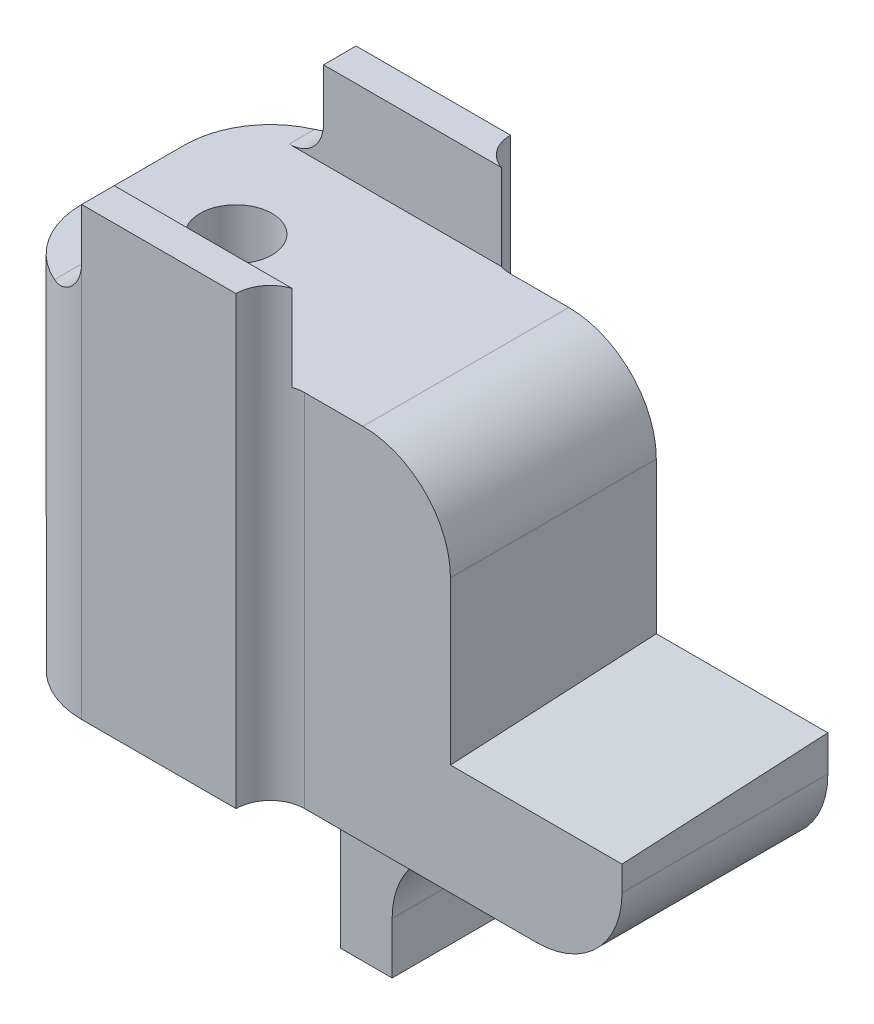
from build123d import *

# Parameters (mm, degrees)
SKETCH1_W           = 12
SKETCH1_H           = 16
SKETCH1_R           = 2.1
SKETCH1_W_2         = 2
BOSS_EXTRUDE1_DEPTH = 21
FILLET1_R           = 5
SKETCH2_W           = 9
SKETCH2_H           = 1.9
BOSS_EXTRUDE2_DEPTH = 5
SKETCH4_W           = 12
SKETCH4_H           = 21
BOSS_EXTRUDE3_DEPTH = 10.5
FILLET2_R           = 5.1
FILLET4_R           = 2
SKETCH6_W           = 3
SKETCH6_H           = 8
BOSS_EXTRUDE5_DEPTH = 8
FILLET6_R           = 2
FILLET8_R           = 5
BOSS_EXTRUDE6_DEPTH = 10
FILLET9_R           = 5


with BuildPart() as part:
    # Sketch1 → Boss-Extrude1 (new body)
    # profile 1 of 2: a face of its own
    with BuildSketch(Plane(origin=(0, 0, 0), x_dir=(1, 0, 0), z_dir=(0, 1, 0))):
        Rectangle(SKETCH1_W, SKETCH1_H)
        with Locations(Location((0, 0, 0), (0, 0, 90))):
            Circle(SKETCH1_R, mode=Mode.SUBTRACT)
    # profile 2 of 2: a face of its own
    with BuildSketch(Plane(origin=(0, 0, 0), x_dir=(1, 0, 0), z_dir=(0, 1, 0))):
        with Locations((7, 0)):
            Rectangle(SKETCH1_W_2, SKETCH1_H)
    extrude(amount=BOSS_EXTRUDE1_DEPTH)

    # Fillet1
    fillet1_edges = [part.edges().sort_by_distance(p)[0] for p in [
        (-6, 10.5, 8),
        (-6, 10.5, -8),
    ]]
    fillet(fillet1_edges, radius=FILLET1_R)

    # Sketch2 → Boss-Extrude2 (add)
    with BuildSketch(Plane(origin=(0, 21, 0), x_dir=(1, 0, 0), z_dir=(0, 1, 0))):
        with Locations((3.5, 7.05)):
            Rectangle(SKETCH2_W, SKETCH2_H)
        with Locations((3.5, -7.05)):
            Rectangle(SKETCH2_W, SKETCH2_H)
    extrude(amount=BOSS_EXTRUDE2_DEPTH)

    # Sketch4 → Boss-Extrude3 (add)
    with BuildSketch(Plane(origin=(8, 0, 0), x_dir=(0, 0, -1), z_dir=(1, 0, 0))):
        with Locations((0, 10.5)):
            Rectangle(SKETCH4_W, SKETCH4_H)
    extrude(amount=BOSS_EXTRUDE3_DEPTH)

    # Fillet2
    fillet2_edges = [part.edges().sort_by_distance(p)[0] for p in [
        (18.5, 21, 0),
    ]]
    fillet(fillet2_edges, radius=FILLET2_R)

    # Fillet4
    fillet4_edges = [part.edges().sort_by_distance(p)[0] for p in [
        (-1, 21, -7.05),
        (-1, 21, 7.05),
        (8, 10.5, -6),
        (8, 10.5, 6),
    ]]
    fillet(fillet4_edges, radius=FILLET4_R - 0.0001)  # a hair under: the kernel refuses the full size

    # Sketch6 → Boss-Extrude5 (add)
    with BuildSketch(Plane.XZ):
        with Locations((11.6, 0)):
            Rectangle(SKETCH6_W, SKETCH6_H)
    extrude(amount=BOSS_EXTRUDE5_DEPTH)

    # Fillet6
    fillet6_edges = [part.edges().sort_by_distance(p)[0] for p in [
        (11.6, 0, -4),
        (11.6, 0, 4),
    ]]
    fillet(fillet6_edges, radius=FILLET6_R - 0.0001)  # a hair under: the kernel refuses the full size

    # Fillet8
    fillet8_edges = [part.edges().sort_by_distance(p)[0] for p in [
        (13.1, 0, 0),
    ]]
    fillet(fillet8_edges, radius=FILLET8_R)

    # Sketch7 → Boss-Extrude6 (add)
    with BuildSketch(Plane(origin=(18.5, 0, 0), x_dir=(0, 0, -1), z_dir=(1, 0, 0))):
        Polygon((-6, 0), (-6, 6.45), (6, 7.078893351), (6, 0), align=None)
    extrude(amount=BOSS_EXTRUDE6_DEPTH)

    # Fillet9
    fillet9_edges = [part.edges().sort_by_distance(p)[0] for p in [
        (28.5, 0, 0),
    ]]
    fillet(fillet9_edges, radius=FILLET9_R)


solid = part.part
